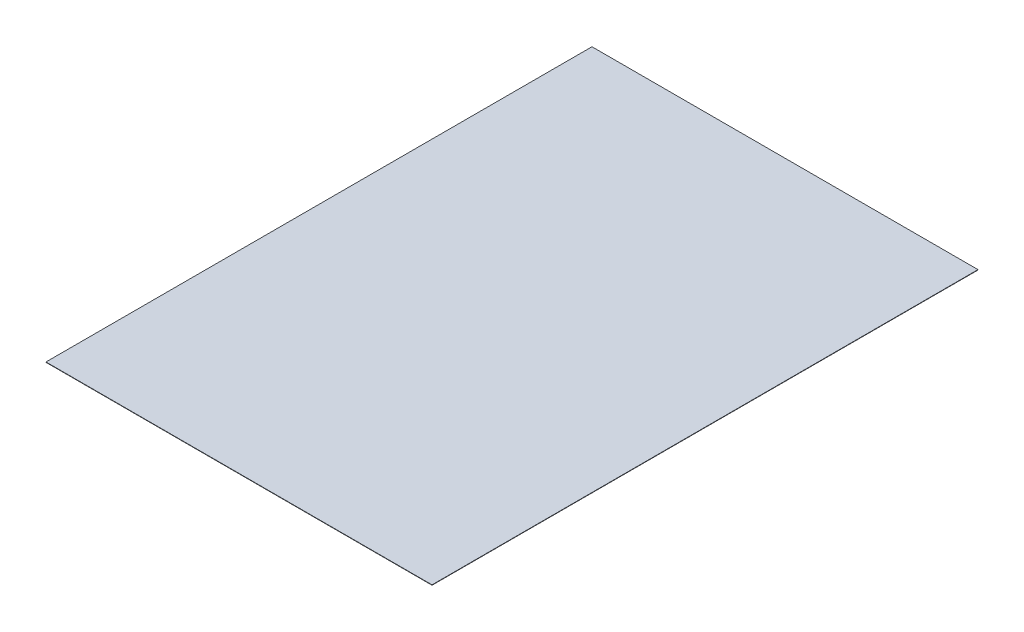
from build123d import *

# Parameters (mm, degrees)
SKETCH1_W      = 210
SKETCH1_H      = 297
EXTRUDE1_DEPTH = 0.2


with BuildPart() as part:
    # Sketch1 → Extrude1 (new body)
    with BuildSketch(Plane(origin=(0, 0, 0), x_dir=(1, 0, 0), z_dir=(0, 1, 0))):
        with Locations((105, 148.5)):
            Rectangle(SKETCH1_W, SKETCH1_H)
    extrude(amount=EXTRUDE1_DEPTH)


solid = part.part
